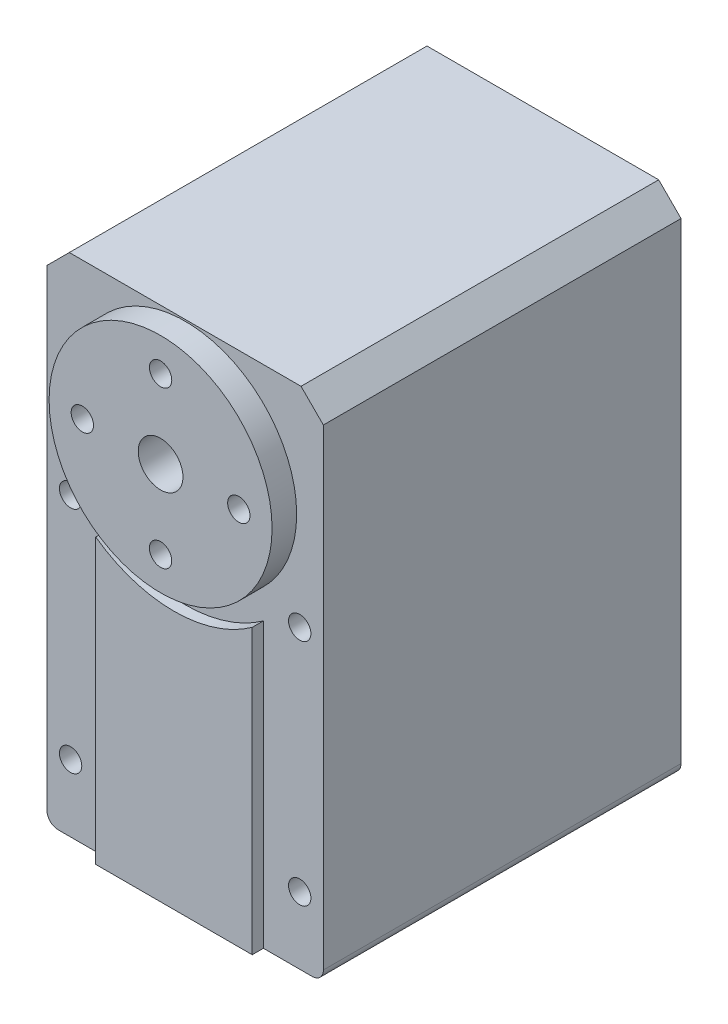
from build123d import *

# Parameters (mm, degrees)
SKETCH_1_W          = 24.73
SKETCH_1_H          = 45.23
EXTRUDE_1_DEPTH     = 32
CHAMFER_1_SIZE      = 2
EXTRUDE_2_DEPTH     = 1
SKETCH_3_R          = 1
CUT_EXTRUDE_1_DEPTH = 4
SKETCH_4_R          = 9.975
EXTRUDE_3_DEPTH     = 2.2
SKETCH_5_R          = 2
SKETCH_5_R_2        = 1
CUT_EXTRUDE_2_DEPTH = 3
SKETCH_6_W          = 20.33
SKETCH_6_H          = 12
EXTRUDE_4_DEPTH     = 2
CHAMFER_2_SIZE      = 2
SKETCH_7_W          = 22.33
SKETCH_7_H          = 5
CUT_EXTRUDE_3_DEPTH = 2
SKETCH_8_R          = 3
EXTRUDE_5_DEPTH     = 4.1
CUT_EXTRUDE_START   = -4
SKETCH_9_R          = 1
CUT_EXTRUDE_4_DEPTH = 4
FILLET_1_R          = 1


with BuildPart() as part:
    # 스케치1 → 보스-돌출1 (new body)
    with BuildSketch(Plane.XY):
        Rectangle(SKETCH_1_W, SKETCH_1_H)
    extrude(amount=EXTRUDE_1_DEPTH)

    # 모따기1
    chamfer_1_edges = [part.edges().sort_by_distance(p)[0] for p in [
        (-12.365, 22.615, 16),
        (12.365, 22.615, 16),
    ]]
    chamfer(chamfer_1_edges, length=CHAMFER_1_SIZE)

    # 스케치2 → 보스-돌출2 (add)
    with BuildSketch(Plane.XY.offset(32)):
        with BuildLine():
            Line((-7, -22.615), (7, -22.615))
            Line((7, -22.615), (7, 2.753205655))
            ThreePointArc((7, 2.753205655), (0, 0.5), (-7, 2.753205655))
            Line((-7, 2.753205655), (-7, -22.615))
        make_face()
    extrude(amount=EXTRUDE_2_DEPTH)

    # 스케치3 → 컷-돌출1 (cut)
    with BuildSketch(Plane.XY.offset(32)):
        with Locations((-10.25, 3.885)):
            Circle(SKETCH_3_R)
        with Locations((-10.25, -16.615)):
            Circle(SKETCH_3_R)
        with Locations((10.25, -16.615)):
            Circle(SKETCH_3_R)
        with Locations((10.25, 3.885)):
            Circle(SKETCH_3_R)
    extrude(amount=-CUT_EXTRUDE_1_DEPTH, mode=Mode.SUBTRACT)

    # 스케치4 → 보스-돌출3 (add)
    with BuildSketch(Plane.XY.offset(32)):
        with Locations((0, 12.5)):
            Circle(SKETCH_4_R)
    extrude(amount=EXTRUDE_3_DEPTH)

    # 스케치5 → 컷-돌출2 (cut)
    with BuildSketch(Plane.XY.offset(34.2)):
        with Locations((0, 12.5)):
            Circle(SKETCH_5_R)
        with Locations((0, 19.5)):
            Circle(SKETCH_5_R_2)
        with Locations((7, 12.5)):
            Circle(SKETCH_5_R_2)
        with Locations((0, 5.5)):
            Circle(SKETCH_5_R_2)
        with Locations((-7, 12.5)):
            Circle(SKETCH_5_R_2)
    extrude(amount=-CUT_EXTRUDE_2_DEPTH, mode=Mode.SUBTRACT)

    # 스케치6 → 보스-돌출4 (add)
    with BuildSketch(Plane(origin=(0, 0, 0), x_dir=(-1, 0, 0), z_dir=(0, 0, -1))):
        with Locations((0, -12.115)):
            Rectangle(SKETCH_6_W, SKETCH_6_H)
    extrude(amount=EXTRUDE_4_DEPTH)

    # 모따기2
    chamfer_2_edges = [part.edges().sort_by_distance(p)[0] for p in [
        (0, -6.115, -2),
    ]]
    chamfer(chamfer_2_edges, length=CHAMFER_2_SIZE - 0.0001)  # a hair under: the kernel refuses the full size

    # 스케치7 → 컷-돌출3 (cut)
    with BuildSketch(Plane(origin=(0, 0, 0), x_dir=(-1, 0, 0), z_dir=(0, 0, -1))):
        with Locations((0, -3.615)):
            Rectangle(SKETCH_7_W, SKETCH_7_H)
    extrude(amount=-CUT_EXTRUDE_3_DEPTH, mode=Mode.SUBTRACT)

    # 스케치8 → 보스-돌출5 (add)
    with BuildSketch(Plane(origin=(0, 0, 0), x_dir=(-1, 0, 0), z_dir=(0, 0, -1))):
        with Locations(Location((0, 12.5, 0), (0, 0, 180))):
            Circle(SKETCH_8_R)
    extrude(amount=EXTRUDE_5_DEPTH)

    # 스케치9 → 컷-돌출4 (cut)
    with BuildSketch(Plane(origin=(0, 0, 0), x_dir=(-1, 0, 0), z_dir=(0, 0, -1)).offset(CUT_EXTRUDE_START)):
        with Locations(Location((-10.25, 3.885, 0), (0, 0, 180))):
            Circle(SKETCH_9_R)
        with Locations(Location((10.25, 3.885, 0), (0, 0, 180))):
            Circle(SKETCH_9_R)
        with Locations((-10.25, -20.615)):
            Circle(SKETCH_9_R)
        with Locations((10.25, -20.615)):
            Circle(SKETCH_9_R)
    extrude(amount=CUT_EXTRUDE_4_DEPTH, mode=Mode.SUBTRACT)

    # 필렛1
    fillet_1_edges = [part.edges().sort_by_distance(p)[0] for p in [
        (12.365, -22.615, 16),
        (-12.365, -22.615, 16),
    ]]
    fillet(fillet_1_edges, radius=FILLET_1_R)


solid = part.part
